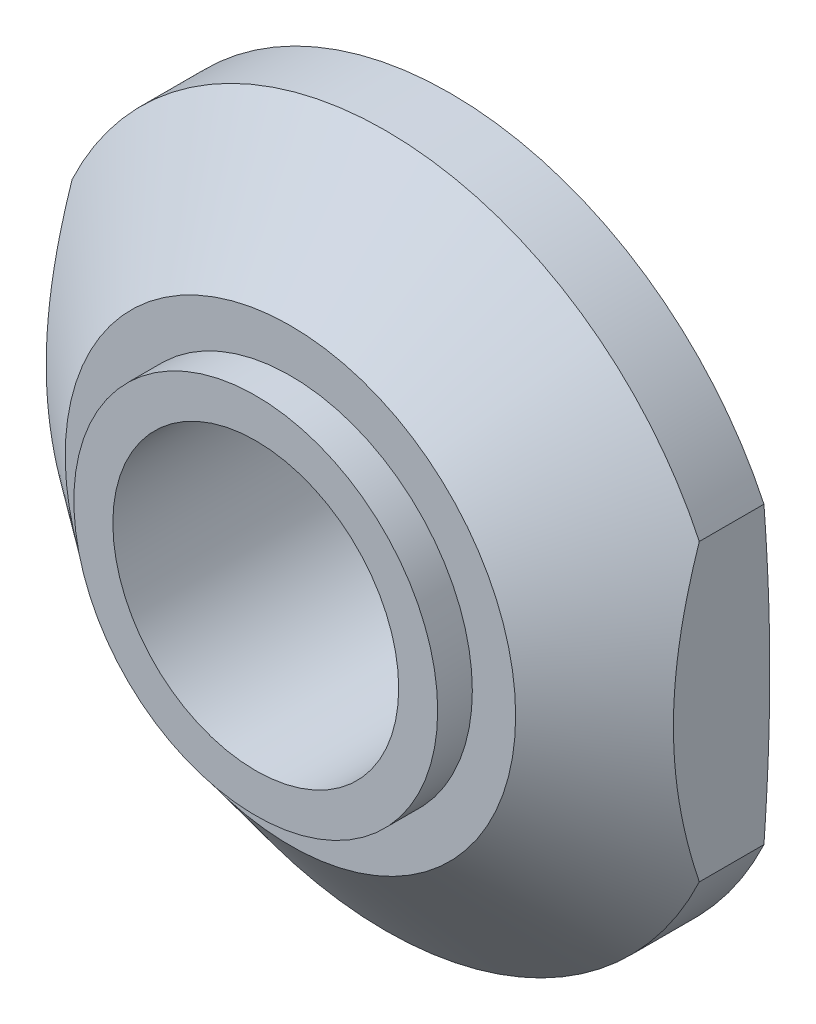
from build123d import *

# Parameters (mm, degrees)
CUT_EXTRUDE1_REACH = 17.402
SKETCH2_W          = 3.052308152
SKETCH2_H          = 16.366405324


with BuildPart() as part:
    # Sketch1 → Revolve1 (revolve)
    with BuildSketch(Plane(origin=(0, 0, 0), x_dir=(0, 0, -1), z_dir=(1, 0, 0))):
        Polygon((0, 4.125), (0, 5.25), (1, 5.25), (1, 6.5), (3.75, 10), (5.615100803, 10), (6.1, 7.25), (6.1, 5.175), (7, 5.175), (7, 4.125), align=None)
    revolve(axis=Axis((0, 0, 0), (0, 0, -1)))

    # Sketch2 → Cut-Extrude1 (cut, up to next)
    with BuildSketch(Plane(origin=(0, 0, -6.1), x_dir=(-1, 0, 0), z_dir=(0, 0, -1)), mode=Mode.PRIVATE) as cut_extrude1_sk1:
        with Locations((10.576154076, 0)):
            Rectangle(SKETCH2_W, SKETCH2_H)
    cut_extrude1_tool1 = extrude(cut_extrude1_sk1.sketch, amount=-CUT_EXTRUDE1_REACH, mode=Mode.PRIVATE) & part.part
    # Sketch2 → Cut-Extrude1 (cut, up to next)
    with BuildSketch(Plane(origin=(0, 0, -6.1), x_dir=(-1, 0, 0), z_dir=(0, 0, -1)), mode=Mode.PRIVATE) as cut_extrude1_sk2:
        with Locations((-10.576154076, 0)):
            Rectangle(SKETCH2_W, SKETCH2_H)
    cut_extrude1_tool2 = extrude(cut_extrude1_sk2.sketch, amount=-CUT_EXTRUDE1_REACH, mode=Mode.PRIVATE) & part.part
    add(cut_extrude1_tool1.solids().sort_by_distance((-10.576154, 0, -6.1))[0], mode=Mode.SUBTRACT)
    add(cut_extrude1_tool2.solids().sort_by_distance((10.576154, 0, -6.1))[0], mode=Mode.SUBTRACT)


solid = part.part
